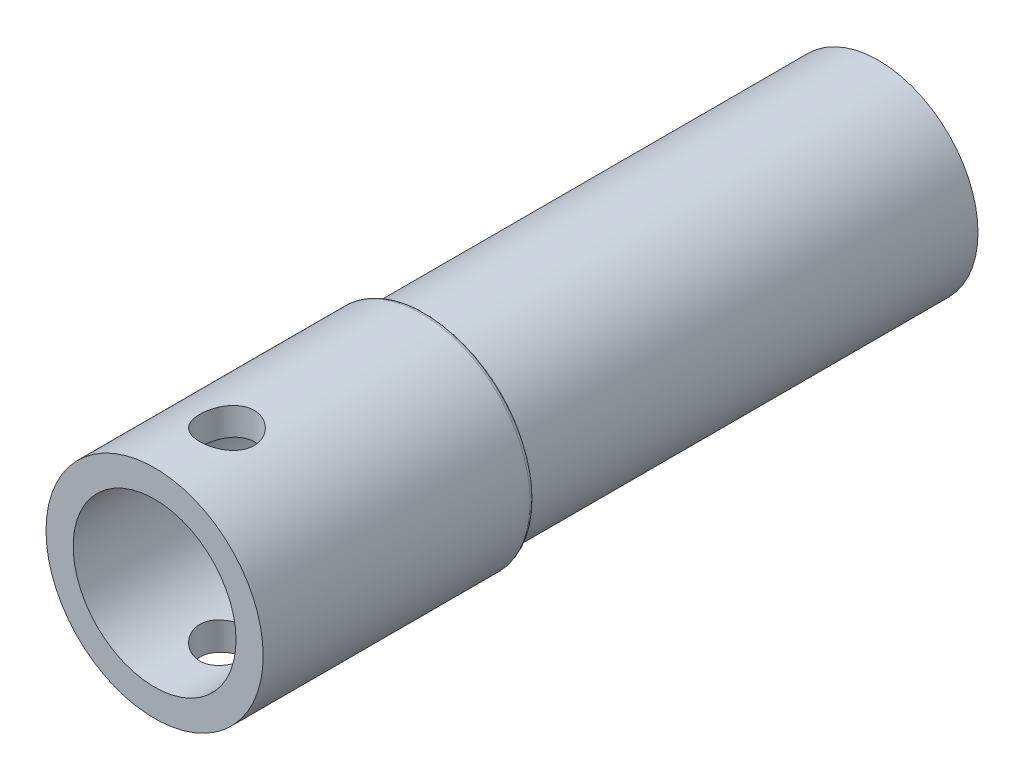
from build123d import *

# Parameters (mm, degrees)
SKETCH1_R               = 12
SKETCH1_R_2             = 9
BOSS_EXTRUDE1_DEPTH     = 30
SKETCH2_R               = 11
BOSS_EXTRUDE2_DEPTH     = 50
SKETCH3_R               = 5
CUT_EXTRUDE1_DEPTH      = 40
CUT_EXTRUDE2_DEPTH      = 53.80151513
CUT_EXTRUDE2_DEPTH_BACK = 53.80151513
SKETCH4_R               = 3
FILLET1_R               = 0.5


with BuildPart() as part:
    # Sketch1 → Boss-Extrude1 (new body)
    with BuildSketch(Plane.XY):
        Circle(SKETCH1_R)
        Circle(SKETCH1_R_2, mode=Mode.SUBTRACT)
    extrude(amount=BOSS_EXTRUDE1_DEPTH)

    # Sketch2 → Boss-Extrude2 (add)
    with BuildSketch(Plane(origin=(0, 0, 0), x_dir=(-1, 0, 0), z_dir=(0, 0, -1))):
        Circle(SKETCH2_R)
    extrude(amount=BOSS_EXTRUDE2_DEPTH)

    # Sketch3 → Cut-Extrude1 (cut)
    with BuildSketch(Plane(origin=(0, 0, -50), x_dir=(-1, 0, 0), z_dir=(0, 0, -1))):
        Circle(SKETCH3_R)
    extrude(amount=-CUT_EXTRUDE1_DEPTH, mode=Mode.SUBTRACT)

    # Sketch4 → Cut-Extrude2 (cut, two sides: drawn at the far end of the back side and taken through both)
    with BuildSketch(Plane(origin=(0, 0, 0), x_dir=(1, 0, 0), z_dir=(0, 1, 0)).offset(-CUT_EXTRUDE2_DEPTH_BACK)):
        with Locations(Location((0, -22, 0), (0, 0, 270))):
            Circle(SKETCH4_R)
    extrude(amount=CUT_EXTRUDE2_DEPTH + CUT_EXTRUDE2_DEPTH_BACK, mode=Mode.SUBTRACT)

    # Fillet1
    fillet1_edges = [part.edges().sort_by_distance(p)[0] for p in [
        (-12, 0, 0),
        (11, 0, 0),
    ]]
    fillet(fillet1_edges, radius=FILLET1_R - 0.0001)  # a hair under: the kernel refuses the full size


solid = part.part
